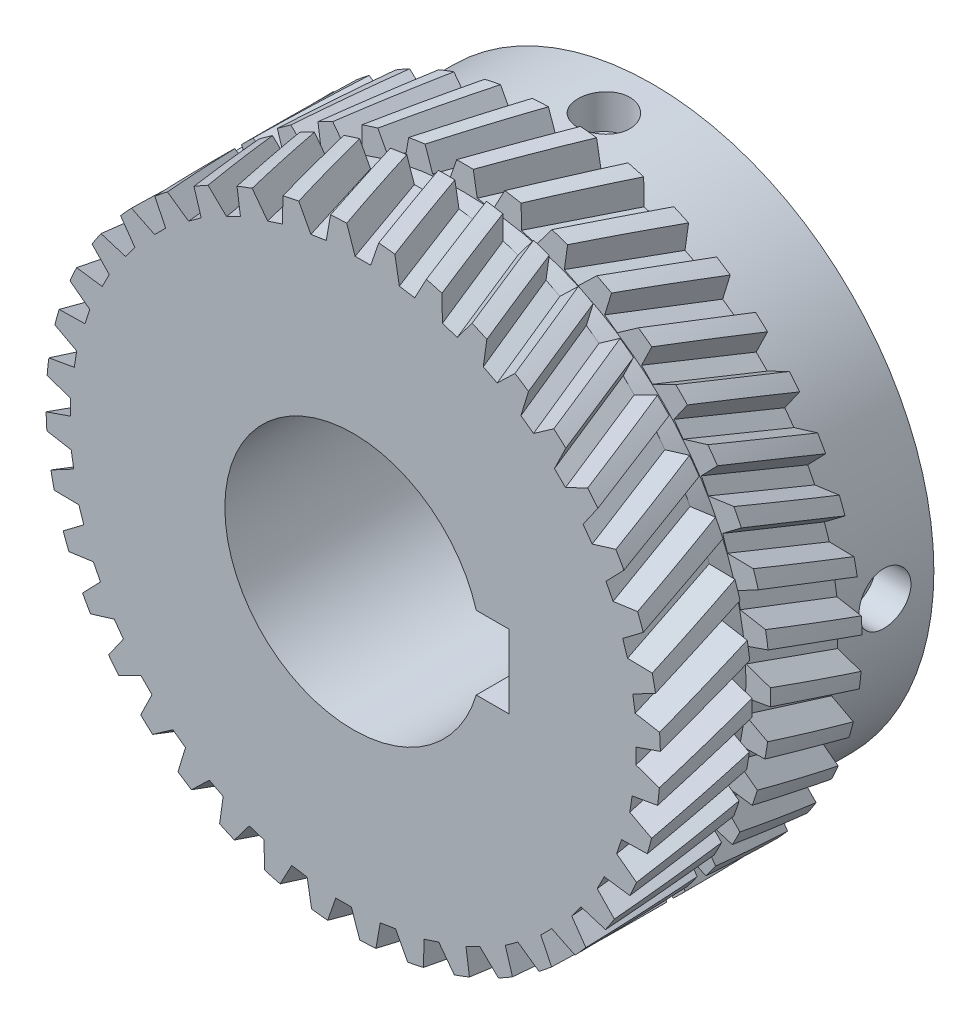
from build123d import *

# Parameters (mm, degrees)
SKETCH1_R                 = 50.2412
BOSS_EXTRUDE1_DEPTH       = 32.9946
SKETCH2_R                 = 45.974
BOSS_EXTRUDE2_DEPTH       = 16.002
CUT_EXTRUDE1_DEPTH        = 4
CUT_EXTRUDE1_DRAFT        = -18
CIRPATTERN2_COPY_1_DEPTH  = 4
CIRPATTERN2_COPY_1_DRAFT  = -18
CIRPATTERN2_COPY_2_DEPTH  = 4
CIRPATTERN2_COPY_2_DRAFT  = -18
CIRPATTERN2_COPY_3_DEPTH  = 4
CIRPATTERN2_COPY_3_DRAFT  = -18
CIRPATTERN2_COPY_4_DEPTH  = 4
CIRPATTERN2_COPY_4_DRAFT  = -18
CIRPATTERN2_COPY_5_DEPTH  = 4
CIRPATTERN2_COPY_5_DRAFT  = -18
CIRPATTERN2_COPY_6_DEPTH  = 4
CIRPATTERN2_COPY_6_DRAFT  = -18
CIRPATTERN2_COPY_7_DEPTH  = 4
CIRPATTERN2_COPY_7_DRAFT  = -18
CIRPATTERN2_COPY_8_DEPTH  = 4
CIRPATTERN2_COPY_8_DRAFT  = -18
CIRPATTERN2_COPY_9_DEPTH  = 4
CIRPATTERN2_COPY_9_DRAFT  = -18
CIRPATTERN2_COPY_10_DEPTH = 4
CIRPATTERN2_COPY_10_DRAFT = -18
CIRPATTERN2_COPY_11_DEPTH = 4
CIRPATTERN2_COPY_11_DRAFT = -18
CIRPATTERN2_COPY_12_DEPTH = 4
CIRPATTERN2_COPY_12_DRAFT = -18
CIRPATTERN2_COPY_13_DEPTH = 4
CIRPATTERN2_COPY_13_DRAFT = -18
CIRPATTERN2_COPY_14_DEPTH = 4
CIRPATTERN2_COPY_14_DRAFT = -18
CIRPATTERN2_COPY_15_DEPTH = 4
CIRPATTERN2_COPY_15_DRAFT = -18
CIRPATTERN2_COPY_16_DEPTH = 4
CIRPATTERN2_COPY_16_DRAFT = -18
CIRPATTERN2_COPY_17_DEPTH = 4
CIRPATTERN2_COPY_17_DRAFT = -18
CIRPATTERN2_COPY_18_DEPTH = 4
CIRPATTERN2_COPY_18_DRAFT = -18
CIRPATTERN2_COPY_19_DEPTH = 4
CIRPATTERN2_COPY_19_DRAFT = -18
CIRPATTERN2_COPY_20_DEPTH = 4
CIRPATTERN2_COPY_20_DRAFT = -18
CIRPATTERN2_COPY_21_DEPTH = 4
CIRPATTERN2_COPY_21_DRAFT = -18
CIRPATTERN2_COPY_22_DEPTH = 4
CIRPATTERN2_COPY_22_DRAFT = -18
CIRPATTERN2_COPY_23_DEPTH = 4
CIRPATTERN2_COPY_23_DRAFT = -18
CIRPATTERN2_COPY_24_DEPTH = 4
CIRPATTERN2_COPY_24_DRAFT = -18
CIRPATTERN2_COPY_25_DEPTH = 4
CIRPATTERN2_COPY_25_DRAFT = -18
CIRPATTERN2_COPY_26_DEPTH = 4
CIRPATTERN2_COPY_26_DRAFT = -18
CIRPATTERN2_COPY_27_DEPTH = 4
CIRPATTERN2_COPY_27_DRAFT = -18
CIRPATTERN2_COPY_28_DEPTH = 4
CIRPATTERN2_COPY_28_DRAFT = -18
CIRPATTERN2_COPY_29_DEPTH = 4
CIRPATTERN2_COPY_29_DRAFT = -18
CIRPATTERN2_COPY_30_DEPTH = 4
CIRPATTERN2_COPY_30_DRAFT = -18
CIRPATTERN2_COPY_31_DEPTH = 4
CIRPATTERN2_COPY_31_DRAFT = -18
CIRPATTERN2_COPY_32_DEPTH = 4
CIRPATTERN2_COPY_32_DRAFT = -18
CIRPATTERN2_COPY_33_DEPTH = 4
CIRPATTERN2_COPY_33_DRAFT = -18
CIRPATTERN2_COPY_34_DEPTH = 4
CIRPATTERN2_COPY_34_DRAFT = -18
CIRPATTERN2_COPY_35_DEPTH = 4
CIRPATTERN2_COPY_35_DRAFT = -18
CIRPATTERN2_COPY_36_DEPTH = 4
CIRPATTERN2_COPY_36_DRAFT = -18
CIRPATTERN2_COPY_37_DEPTH = 4
CIRPATTERN2_COPY_37_DRAFT = -18
CIRPATTERN2_COPY_38_DEPTH = 4
CIRPATTERN2_COPY_38_DRAFT = -18
CIRPATTERN2_COPY_39_DEPTH = 4
CIRPATTERN2_COPY_39_DRAFT = -18
CUT_EXTRUDE8_DEPTH        = 1.4986
CUT_EXTRUDE8_DEPTH_BACK   = 1.4986
SKETCH17_R                = 51.972836746
SKETCH17_R_2              = 46.242248426
CUT_EXTRUDE3_DEPTH        = 87.307723678
SKETCH10_R                = 4.25
CUT_EXTRUDE6_DEPTH        = 10
SKETCH11_R                = 4.25
CUT_EXTRUDE7_DEPTH        = 10
M8_TAPPED_HOLE1_D         = 6.8
M8_TAPPED_HOLE1_DEPTH     = 32.995
M8_TAPPED_HOLE1_TIP       = 2.042926105
M8_TAPPED_HOLE2_D         = 6.8
M8_TAPPED_HOLE2_DEPTH     = 32.995
M8_TAPPED_HOLE2_TIP       = 2.042926105


with BuildPart() as part:
    # Sketch1 → Boss-Extrude1 (new body)
    with BuildSketch(Plane.XY):
        Circle(SKETCH1_R)
    extrude(amount=BOSS_EXTRUDE1_DEPTH)

    # Sketch2 → Boss-Extrude2 (add)
    with BuildSketch(Plane(origin=(0, 0, 0), x_dir=(-1, 0, 0), z_dir=(0, 0, -1))):
        Circle(SKETCH2_R)
    extrude(amount=BOSS_EXTRUDE2_DEPTH)


with BuildPart() as cut_extrude1_tool:
    # Sketch4 → Cut-Extrude1 (with draft: the straight prism first)
    with BuildSketch(Plane(origin=(50.2412, 0, 0), x_dir=(0, 0, -1), z_dir=(1, 0, 0))):
        Polygon((-16.4946, 6.910378281), (-34.4946, 0.536194418), (-34.4946, -4.768053675), (-16.4946, 1.606130188), (1.5, -4.768053675), (1.5, 0.536194418), align=None)
    extrude(amount=-CUT_EXTRUDE1_DEPTH)
    # Cut-Extrude1: the draft: its side faces are tilted about the plane it starts from
    cut_extrude1_sides = [cut_extrude1_tool.faces().sort_by_distance(p)[0] for p in [
        (48.2412, 3.72328635, 25.4946),
        (48.2412, -2.115929628, 34.4946),
        (48.2412, -1.580961743, 25.4946),
        (48.2412, -1.580961743, 7.4973),
        (48.2412, -2.115929628, -1.5),
        (48.2412, 3.72328635, 7.4973),
    ]]
    draft(cut_extrude1_sides, Plane(origin=(50.2412, 0, 0), x_dir=(0, 0, -1), z_dir=(1, 0, 0)), CUT_EXTRUDE1_DRAFT)


with BuildPart() as part_1:
    add(part.part)

    # Cut-Extrude1: cut by cut_extrude1_tool
    add(cut_extrude1_tool.part, mode=Mode.SUBTRACT)


with BuildPart() as cirpattern2_copy_1_tool:
    # CirPattern2 copy 1 sketch → CirPattern2 copy 1 (with draft: the straight prism first)
    with BuildSketch(Plane(origin=(49.622647458, -7.859455245, 0), x_dir=(0, 0, -1), z_dir=(0.9876883405951378, -0.15643446504023087, 0))):
        Polygon((-16.4946, 6.910378281), (-34.4946, 0.536194418), (-34.4946, -4.768053675), (-16.4946, 1.606130188), (1.5, -4.768053675), (1.5, 0.536194418), align=None)
    extrude(amount=-CIRPATTERN2_COPY_1_DEPTH)
    # CirPattern2 copy 1: the draft: its side faces are tilted about the plane it starts from
    cirpattern2_copy_1_sides = [cirpattern2_copy_1_tool.faces().sort_by_distance(p)[0] for p in [
        (48.229721085, -3.869139798, 25.4946),
        (47.316266457, -9.636465338, 34.4946),
        (47.399953872, -9.108083795, 25.4946),
        (47.399953872, -9.108083795, 7.4973),
        (47.316266457, -9.636465338, -1.5),
        (48.229721085, -3.869139798, 7.4973),
    ]]
    draft(cirpattern2_copy_1_sides, Plane(origin=(49.622647458, -7.859455245, 0), x_dir=(0, 0, -1), z_dir=(0.9876883405951378, -0.15643446504023087, 0)), CIRPATTERN2_COPY_1_DRAFT)


with BuildPart() as part_2:
    add(part_1.part)

    # CirPattern2 copy 1: cut by cirpattern2_copy_1_tool
    add(cirpattern2_copy_1_tool.part, mode=Mode.SUBTRACT)


with BuildPart() as cirpattern2_copy_2_tool:
    # CirPattern2 copy 2 sketch → CirPattern2 copy 2 (with draft: the straight prism first)
    with BuildSketch(Plane(origin=(47.782220646, -15.525384618, 0), x_dir=(0, 0, -1), z_dir=(0.9510565162951535, -0.3090169943749474, 0))):
        Polygon((-16.4946, 6.910378281), (-34.4946, 0.536194418), (-34.4946, -4.768053675), (-16.4946, 1.606130188), (1.5, -4.768053675), (1.5, 0.536194418), align=None)
    extrude(amount=-CIRPATTERN2_COPY_2_DEPTH)
    # CirPattern2 copy 2: the draft: its side faces are tilted about the plane it starts from
    cirpattern2_copy_2_sides = [cirpattern2_copy_2_tool.faces().sort_by_distance(p)[0] for p in [
        (47.030666371, -11.366294884, 25.4946),
        (45.2262494, -16.91971929, 34.4946),
        (45.391563568, -16.410934597, 25.4946),
        (45.391563568, -16.410934597, 7.4973),
        (45.2262494, -16.91971929, -1.5),
        (47.030666371, -11.366294884, 7.4973),
    ]]
    draft(cirpattern2_copy_2_sides, Plane(origin=(47.782220646, -15.525384618, 0), x_dir=(0, 0, -1), z_dir=(0.9510565162951535, -0.3090169943749474, 0)), CIRPATTERN2_COPY_2_DRAFT)


with BuildPart() as part_3:
    add(part_2.part)

    # CirPattern2 copy 2: cut by cirpattern2_copy_2_tool
    add(cirpattern2_copy_2_tool.part, mode=Mode.SUBTRACT)


with BuildPart() as cirpattern2_copy_3_tool:
    # CirPattern2 copy 3 sketch → CirPattern2 copy 3 (with draft: the straight prism first)
    with BuildSketch(Plane(origin=(44.765236983, -22.809027496, 0), x_dir=(0, 0, -1), z_dir=(0.8910065241883679, -0.45399049973954675, 0))):
        Polygon((-16.4946, 6.910378281), (-34.4946, 0.536194418), (-34.4946, -4.768053675), (-16.4946, 1.606130188), (1.5, -4.768053675), (1.5, 0.536194418), align=None)
    extrude(amount=-CIRPATTERN2_COPY_3_DEPTH)
    # CirPattern2 copy 3: the draft: its side faces are tilted about the plane it starts from
    cirpattern2_copy_3_sides = [cirpattern2_copy_3_tool.faces().sort_by_distance(p)[0] for p in [
        (44.673560565, -18.583574067, 25.4946),
        (42.022611985, -23.786353599, 34.4946),
        (42.265482323, -23.309693724, 25.4946),
        (42.265482323, -23.309693724, 7.4973),
        (42.022611985, -23.786353599, -1.5),
        (44.673560565, -18.583574067, 7.4973),
    ]]
    draft(cirpattern2_copy_3_sides, Plane(origin=(44.765236983, -22.809027496, 0), x_dir=(0, 0, -1), z_dir=(0.8910065241883679, -0.45399049973954675, 0)), CIRPATTERN2_COPY_3_DRAFT)


with BuildPart() as part_4:
    add(part_3.part)

    # CirPattern2 copy 3: cut by cirpattern2_copy_3_tool
    add(cirpattern2_copy_3_tool.part, mode=Mode.SUBTRACT)


with BuildPart() as cirpattern2_copy_4_tool:
    # CirPattern2 copy 4 sketch → CirPattern2 copy 4 (with draft: the straight prism first)
    with BuildSketch(Plane(origin=(40.645984618, -29.531036417, 0), x_dir=(0, 0, -1), z_dir=(0.8090169943749475, -0.5877852522924731, 0))):
        Polygon((-16.4946, 6.910378281), (-34.4946, 0.536194418), (-34.4946, -4.768053675), (-16.4946, 1.606130188), (1.5, -4.768053675), (1.5, 0.536194418), align=None)
    extrude(amount=-CIRPATTERN2_COPY_4_DEPTH)
    # CirPattern2 copy 4: the draft: its side faces are tilted about the plane it starts from
    cirpattern2_copy_4_sides = [cirpattern2_copy_4_tool.faces().sort_by_distance(p)[0] for p in [
        (41.216443436, -25.343263981, 25.4946),
        (37.784238399, -30.067288941, 34.4946),
        (38.098684632, -29.63449083, 25.4946),
        (38.098684632, -29.63449083, 7.4973),
        (37.784238399, -30.067288941, -1.5),
        (41.216443436, -25.343263981, 7.4973),
    ]]
    draft(cirpattern2_copy_4_sides, Plane(origin=(40.645984618, -29.531036417, 0), x_dir=(0, 0, -1), z_dir=(0.8090169943749475, -0.5877852522924731, 0)), CIRPATTERN2_COPY_4_DRAFT)


with BuildPart() as part_5:
    add(part_4.part)

    # CirPattern2 copy 4: cut by cirpattern2_copy_4_tool
    add(cirpattern2_copy_4_tool.part, mode=Mode.SUBTRACT)


with BuildPart() as cirpattern2_copy_5_tool:
    # CirPattern2 copy 5 sketch → CirPattern2 copy 5 (with draft: the straight prism first)
    with BuildSketch(Plane(origin=(35.525893215, -35.525893215, 0), x_dir=(0, 0, -1), z_dir=(0.7071067811865476, -0.7071067811865475, 0))):
        Polygon((-16.4946, 6.910378281), (-34.4946, 0.536194418), (-34.4946, -4.768053675), (-16.4946, 1.606130188), (1.5, -4.768053675), (1.5, 0.536194418), align=None)
    extrude(amount=-CIRPATTERN2_COPY_5_DEPTH)
    # CirPattern2 copy 5: the draft: its side faces are tilted about the plane it starts from
    cirpattern2_copy_5_sides = [cirpattern2_copy_5_tool.faces().sort_by_distance(p)[0] for p in [
        (36.744440679, -31.478918626, 25.4946),
        (32.615491464, -35.607867841, 34.4946),
        (32.993770883, -35.229588422, 25.4946),
        (32.993770883, -35.229588422, 7.4973),
        (32.615491464, -35.607867841, -1.5),
        (36.744440679, -31.478918626, 7.4973),
    ]]
    draft(cirpattern2_copy_5_sides, Plane(origin=(35.525893215, -35.525893215, 0), x_dir=(0, 0, -1), z_dir=(0.7071067811865476, -0.7071067811865475, 0)), CIRPATTERN2_COPY_5_DRAFT)


with BuildPart() as part_6:
    add(part_5.part)

    # CirPattern2 copy 5: cut by cirpattern2_copy_5_tool
    add(cirpattern2_copy_5_tool.part, mode=Mode.SUBTRACT)


with BuildPart() as cirpattern2_copy_6_tool:
    # CirPattern2 copy 6 sketch → CirPattern2 copy 6 (with draft: the straight prism first)
    with BuildSketch(Plane(origin=(29.531036417, -40.645984618, 0), x_dir=(0, 0, -1), z_dir=(0.5877852522924731, -0.8090169943749475, 0))):
        Polygon((-16.4946, 6.910378281), (-34.4946, 0.536194418), (-34.4946, -4.768053675), (-16.4946, 1.606130188), (1.5, -4.768053675), (1.5, 0.536194418), align=None)
    extrude(amount=-CIRPATTERN2_COPY_6_DEPTH)
    # CirPattern2 copy 6: the draft: its side faces are tilted about the plane it starts from
    cirpattern2_copy_6_sides = [cirpattern2_copy_6_tool.faces().sort_by_distance(p)[0] for p in [
        (31.367667845, -36.839457822, 25.4946),
        (26.643642885, -40.271662859, 34.4946),
        (27.076440995, -39.957216626, 25.4946),
        (27.076440995, -39.957216626, 7.4973),
        (26.643642885, -40.271662859, -1.5),
        (31.367667845, -36.839457822, 7.4973),
    ]]
    draft(cirpattern2_copy_6_sides, Plane(origin=(29.531036417, -40.645984618, 0), x_dir=(0, 0, -1), z_dir=(0.5877852522924731, -0.8090169943749475, 0)), CIRPATTERN2_COPY_6_DRAFT)


with BuildPart() as part_7:
    add(part_6.part)

    # CirPattern2 copy 6: cut by cirpattern2_copy_6_tool
    add(cirpattern2_copy_6_tool.part, mode=Mode.SUBTRACT)


with BuildPart() as cirpattern2_copy_7_tool:
    # CirPattern2 copy 7 sketch → CirPattern2 copy 7 (with draft: the straight prism first)
    with BuildSketch(Plane(origin=(22.809027496, -44.765236983, 0), x_dir=(0, 0, -1), z_dir=(0.4539904997395468, -0.8910065241883678, 0))):
        Polygon((-16.4946, 6.910378281), (-34.4946, 0.536194418), (-34.4946, -4.768053675), (-16.4946, 1.606130188), (1.5, -4.768053675), (1.5, 0.536194418), align=None)
    extrude(amount=-CIRPATTERN2_COPY_7_DEPTH)
    # CirPattern2 copy 7: the draft: its side faces are tilted about the plane it starts from
    cirpattern2_copy_7_sides = [cirpattern2_copy_7_tool.faces().sort_by_distance(p)[0] for p in [
        (25.218518925, -41.292887304, 25.4946),
        (20.015739393, -43.943835884, 34.4946),
        (20.492399269, -43.700965546, 25.4946),
        (20.492399269, -43.700965546, 7.4973),
        (20.015739393, -43.943835884, -1.5),
        (25.218518925, -41.292887304, 7.4973),
    ]]
    draft(cirpattern2_copy_7_sides, Plane(origin=(22.809027496, -44.765236983, 0), x_dir=(0, 0, -1), z_dir=(0.4539904997395468, -0.8910065241883678, 0)), CIRPATTERN2_COPY_7_DRAFT)


with BuildPart() as part_8:
    add(part_7.part)

    # CirPattern2 copy 7: cut by cirpattern2_copy_7_tool
    add(cirpattern2_copy_7_tool.part, mode=Mode.SUBTRACT)


with BuildPart() as cirpattern2_copy_8_tool:
    # CirPattern2 copy 8 sketch → CirPattern2 copy 8 (with draft: the straight prism first)
    with BuildSketch(Plane(origin=(15.525384618, -47.782220646, 0), x_dir=(0, 0, -1), z_dir=(0.30901699437494745, -0.9510565162951535, 0))):
        Polygon((-16.4946, 6.910378281), (-34.4946, 0.536194418), (-34.4946, -4.768053675), (-16.4946, 1.606130188), (1.5, -4.768053675), (1.5, 0.536194418), align=None)
    extrude(amount=-CIRPATTERN2_COPY_8_DEPTH)
    # CirPattern2 copy 8: the draft: its side faces are tilted about the plane it starts from
    cirpattern2_copy_8_sides = [cirpattern2_copy_8_tool.faces().sort_by_distance(p)[0] for p in [
        (18.448406374, -44.729548857, 25.4946),
        (12.894981968, -46.533965828, 34.4946),
        (13.403766661, -46.36865166, 25.4946),
        (13.403766661, -46.36865166, 7.4973),
        (12.894981968, -46.533965828, -1.5),
        (18.448406374, -44.729548857, 7.4973),
    ]]
    draft(cirpattern2_copy_8_sides, Plane(origin=(15.525384618, -47.782220646, 0), x_dir=(0, 0, -1), z_dir=(0.30901699437494745, -0.9510565162951535, 0)), CIRPATTERN2_COPY_8_DRAFT)


with BuildPart() as part_9:
    add(part_8.part)

    # CirPattern2 copy 8: cut by cirpattern2_copy_8_tool
    add(cirpattern2_copy_8_tool.part, mode=Mode.SUBTRACT)


with BuildPart() as cirpattern2_copy_9_tool:
    # CirPattern2 copy 9 sketch → CirPattern2 copy 9 (with draft: the straight prism first)
    with BuildSketch(Plane(origin=(7.859455245, -49.622647458, 0), x_dir=(0, 0, -1), z_dir=(0.15643446504023092, -0.9876883405951378, 0))):
        Polygon((-16.4946, 6.910378281), (-34.4946, 0.536194418), (-34.4946, -4.768053675), (-16.4946, 1.606130188), (1.5, -4.768053675), (1.5, 0.536194418), align=None)
    extrude(amount=-CIRPATTERN2_COPY_9_DEPTH)
    # CirPattern2 copy 9: the draft: its side faces are tilted about the plane it starts from
    cirpattern2_copy_9_sides = [cirpattern2_copy_9_tool.faces().sort_by_distance(p)[0] for p in [
        (11.224032831, -47.064820468, 25.4946),
        (5.456707292, -47.978275096, 34.4946),
        (5.985088834, -47.894587681, 25.4946),
        (5.985088834, -47.894587681, 7.4973),
        (5.456707292, -47.978275096, -1.5),
        (11.224032831, -47.064820468, 7.4973),
    ]]
    draft(cirpattern2_copy_9_sides, Plane(origin=(7.859455245, -49.622647458, 0), x_dir=(0, 0, -1), z_dir=(0.15643446504023092, -0.9876883405951378, 0)), CIRPATTERN2_COPY_9_DRAFT)


with BuildPart() as part_10:
    add(part_9.part)

    # CirPattern2 copy 9: cut by cirpattern2_copy_9_tool
    add(cirpattern2_copy_9_tool.part, mode=Mode.SUBTRACT)


with BuildPart() as cirpattern2_copy_10_tool:
    # CirPattern2 copy 10 sketch → CirPattern2 copy 10 (with draft: the straight prism first)
    with BuildSketch(Plane(origin=(0, -50.2412, 0), x_dir=(0, 0, -1), z_dir=(0, -1, 0))):
        Polygon((-16.4946, 6.910378281), (-34.4946, 0.536194418), (-34.4946, -4.768053675), (-16.4946, 1.606130188), (1.5, -4.768053675), (1.5, 0.536194418), align=None)
    extrude(amount=-CIRPATTERN2_COPY_10_DEPTH)
    # CirPattern2 copy 10: the draft: its side faces are tilted about the plane it starts from
    cirpattern2_copy_10_sides = [cirpattern2_copy_10_tool.faces().sort_by_distance(p)[0] for p in [
        (3.72328635, -48.2412, 25.4946),
        (-2.115929628, -48.2412, 34.4946),
        (-1.580961743, -48.2412, 25.4946),
        (-1.580961743, -48.2412, 7.4973),
        (-2.115929628, -48.2412, -1.5),
        (3.72328635, -48.2412, 7.4973),
    ]]
    draft(cirpattern2_copy_10_sides, Plane(origin=(0, -50.2412, 0), x_dir=(0, 0, -1), z_dir=(0, -1, 0)), CIRPATTERN2_COPY_10_DRAFT)


with BuildPart() as part_11:
    add(part_10.part)

    # CirPattern2 copy 10: cut by cirpattern2_copy_10_tool
    add(cirpattern2_copy_10_tool.part, mode=Mode.SUBTRACT)


with BuildPart() as cirpattern2_copy_11_tool:
    # CirPattern2 copy 11 sketch → CirPattern2 copy 11 (with draft: the straight prism first)
    with BuildSketch(Plane(origin=(-7.859455245, -49.622647458, 0), x_dir=(0, 0, -1), z_dir=(-0.1564344650402308, -0.9876883405951378, 0))):
        Polygon((-16.4946, 6.910378281), (-34.4946, 0.536194418), (-34.4946, -4.768053675), (-16.4946, 1.606130188), (1.5, -4.768053675), (1.5, 0.536194418), align=None)
    extrude(amount=-CIRPATTERN2_COPY_11_DEPTH)
    # CirPattern2 copy 11: the draft: its side faces are tilted about the plane it starts from
    cirpattern2_copy_11_sides = [cirpattern2_copy_11_tool.faces().sort_by_distance(p)[0] for p in [
        (-3.869139798, -48.229721085, 25.4946),
        (-9.636465338, -47.316266457, 34.4946),
        (-9.108083795, -47.399953872, 25.4946),
        (-9.108083795, -47.399953872, 7.4973),
        (-9.636465338, -47.316266457, -1.5),
        (-3.869139798, -48.229721085, 7.4973),
    ]]
    draft(cirpattern2_copy_11_sides, Plane(origin=(-7.859455245, -49.622647458, 0), x_dir=(0, 0, -1), z_dir=(-0.1564344650402308, -0.9876883405951378, 0)), CIRPATTERN2_COPY_11_DRAFT)


with BuildPart() as part_12:
    add(part_11.part)

    # CirPattern2 copy 11: cut by cirpattern2_copy_11_tool
    add(cirpattern2_copy_11_tool.part, mode=Mode.SUBTRACT)


with BuildPart() as cirpattern2_copy_12_tool:
    # CirPattern2 copy 12 sketch → CirPattern2 copy 12 (with draft: the straight prism first)
    with BuildSketch(Plane(origin=(-15.525384618, -47.782220646, 0), x_dir=(0, 0, -1), z_dir=(-0.30901699437494734, -0.9510565162951536, 0))):
        Polygon((-16.4946, 6.910378281), (-34.4946, 0.536194418), (-34.4946, -4.768053675), (-16.4946, 1.606130188), (1.5, -4.768053675), (1.5, 0.536194418), align=None)
    extrude(amount=-CIRPATTERN2_COPY_12_DEPTH)
    # CirPattern2 copy 12: the draft: its side faces are tilted about the plane it starts from
    cirpattern2_copy_12_sides = [cirpattern2_copy_12_tool.faces().sort_by_distance(p)[0] for p in [
        (-11.366294884, -47.030666371, 25.4946),
        (-16.91971929, -45.2262494, 34.4946),
        (-16.410934597, -45.391563568, 25.4946),
        (-16.410934597, -45.391563568, 7.4973),
        (-16.91971929, -45.2262494, -1.5),
        (-11.366294884, -47.030666371, 7.4973),
    ]]
    draft(cirpattern2_copy_12_sides, Plane(origin=(-15.525384618, -47.782220646, 0), x_dir=(0, 0, -1), z_dir=(-0.30901699437494734, -0.9510565162951536, 0)), CIRPATTERN2_COPY_12_DRAFT)


with BuildPart() as part_13:
    add(part_12.part)

    # CirPattern2 copy 12: cut by cirpattern2_copy_12_tool
    add(cirpattern2_copy_12_tool.part, mode=Mode.SUBTRACT)


with BuildPart() as cirpattern2_copy_13_tool:
    # CirPattern2 copy 13 sketch → CirPattern2 copy 13 (with draft: the straight prism first)
    with BuildSketch(Plane(origin=(-22.809027496, -44.765236983, 0), x_dir=(0, 0, -1), z_dir=(-0.4539904997395467, -0.8910065241883679, 0))):
        Polygon((-16.4946, 6.910378281), (-34.4946, 0.536194418), (-34.4946, -4.768053675), (-16.4946, 1.606130188), (1.5, -4.768053675), (1.5, 0.536194418), align=None)
    extrude(amount=-CIRPATTERN2_COPY_13_DEPTH)
    # CirPattern2 copy 13: the draft: its side faces are tilted about the plane it starts from
    cirpattern2_copy_13_sides = [cirpattern2_copy_13_tool.faces().sort_by_distance(p)[0] for p in [
        (-18.583574067, -44.673560565, 25.4946),
        (-23.786353599, -42.022611985, 34.4946),
        (-23.309693724, -42.265482323, 25.4946),
        (-23.309693724, -42.265482323, 7.4973),
        (-23.786353599, -42.022611985, -1.5),
        (-18.583574067, -44.673560565, 7.4973),
    ]]
    draft(cirpattern2_copy_13_sides, Plane(origin=(-22.809027496, -44.765236983, 0), x_dir=(0, 0, -1), z_dir=(-0.4539904997395467, -0.8910065241883679, 0)), CIRPATTERN2_COPY_13_DRAFT)


with BuildPart() as part_14:
    add(part_13.part)

    # CirPattern2 copy 13: cut by cirpattern2_copy_13_tool
    add(cirpattern2_copy_13_tool.part, mode=Mode.SUBTRACT)


with BuildPart() as cirpattern2_copy_14_tool:
    # CirPattern2 copy 14 sketch → CirPattern2 copy 14 (with draft: the straight prism first)
    with BuildSketch(Plane(origin=(-29.531036417, -40.645984618, 0), x_dir=(0, 0, -1), z_dir=(-0.587785252292473, -0.8090169943749475, 0))):
        Polygon((-16.4946, 6.910378281), (-34.4946, 0.536194418), (-34.4946, -4.768053675), (-16.4946, 1.606130188), (1.5, -4.768053675), (1.5, 0.536194418), align=None)
    extrude(amount=-CIRPATTERN2_COPY_14_DEPTH)
    # CirPattern2 copy 14: the draft: its side faces are tilted about the plane it starts from
    cirpattern2_copy_14_sides = [cirpattern2_copy_14_tool.faces().sort_by_distance(p)[0] for p in [
        (-25.343263981, -41.216443436, 25.4946),
        (-30.067288941, -37.784238399, 34.4946),
        (-29.63449083, -38.098684632, 25.4946),
        (-29.63449083, -38.098684632, 7.4973),
        (-30.067288941, -37.784238399, -1.5),
        (-25.343263981, -41.216443436, 7.4973),
    ]]
    draft(cirpattern2_copy_14_sides, Plane(origin=(-29.531036417, -40.645984618, 0), x_dir=(0, 0, -1), z_dir=(-0.587785252292473, -0.8090169943749475, 0)), CIRPATTERN2_COPY_14_DRAFT)


with BuildPart() as part_15:
    add(part_14.part)

    # CirPattern2 copy 14: cut by cirpattern2_copy_14_tool
    add(cirpattern2_copy_14_tool.part, mode=Mode.SUBTRACT)


with BuildPart() as cirpattern2_copy_15_tool:
    # CirPattern2 copy 15 sketch → CirPattern2 copy 15 (with draft: the straight prism first)
    with BuildSketch(Plane(origin=(-35.525893215, -35.525893215, 0), x_dir=(0, 0, -1), z_dir=(-0.7071067811865475, -0.7071067811865476, 0))):
        Polygon((-16.4946, 6.910378281), (-34.4946, 0.536194418), (-34.4946, -4.768053675), (-16.4946, 1.606130188), (1.5, -4.768053675), (1.5, 0.536194418), align=None)
    extrude(amount=-CIRPATTERN2_COPY_15_DEPTH)
    # CirPattern2 copy 15: the draft: its side faces are tilted about the plane it starts from
    cirpattern2_copy_15_sides = [cirpattern2_copy_15_tool.faces().sort_by_distance(p)[0] for p in [
        (-31.478918626, -36.744440679, 25.4946),
        (-35.607867841, -32.615491464, 34.4946),
        (-35.229588422, -32.993770883, 25.4946),
        (-35.229588422, -32.993770883, 7.4973),
        (-35.607867841, -32.615491464, -1.5),
        (-31.478918626, -36.744440679, 7.4973),
    ]]
    draft(cirpattern2_copy_15_sides, Plane(origin=(-35.525893215, -35.525893215, 0), x_dir=(0, 0, -1), z_dir=(-0.7071067811865475, -0.7071067811865476, 0)), CIRPATTERN2_COPY_15_DRAFT)


with BuildPart() as part_16:
    add(part_15.part)

    # CirPattern2 copy 15: cut by cirpattern2_copy_15_tool
    add(cirpattern2_copy_15_tool.part, mode=Mode.SUBTRACT)


with BuildPart() as cirpattern2_copy_16_tool:
    # CirPattern2 copy 16 sketch → CirPattern2 copy 16 (with draft: the straight prism first)
    with BuildSketch(Plane(origin=(-40.645984618, -29.531036417, 0), x_dir=(0, 0, -1), z_dir=(-0.8090169943749473, -0.5877852522924732, 0))):
        Polygon((-16.4946, 6.910378281), (-34.4946, 0.536194418), (-34.4946, -4.768053675), (-16.4946, 1.606130188), (1.5, -4.768053675), (1.5, 0.536194418), align=None)
    extrude(amount=-CIRPATTERN2_COPY_16_DEPTH)
    # CirPattern2 copy 16: the draft: its side faces are tilted about the plane it starts from
    cirpattern2_copy_16_sides = [cirpattern2_copy_16_tool.faces().sort_by_distance(p)[0] for p in [
        (-36.839457822, -31.367667845, 25.4946),
        (-40.271662859, -26.643642885, 34.4946),
        (-39.957216626, -27.076440995, 25.4946),
        (-39.957216626, -27.076440995, 7.4973),
        (-40.271662859, -26.643642885, -1.5),
        (-36.839457822, -31.367667845, 7.4973),
    ]]
    draft(cirpattern2_copy_16_sides, Plane(origin=(-40.645984618, -29.531036417, 0), x_dir=(0, 0, -1), z_dir=(-0.8090169943749473, -0.5877852522924732, 0)), CIRPATTERN2_COPY_16_DRAFT)


with BuildPart() as part_17:
    add(part_16.part)

    # CirPattern2 copy 16: cut by cirpattern2_copy_16_tool
    add(cirpattern2_copy_16_tool.part, mode=Mode.SUBTRACT)


with BuildPart() as cirpattern2_copy_17_tool:
    # CirPattern2 copy 17 sketch → CirPattern2 copy 17 (with draft: the straight prism first)
    with BuildSketch(Plane(origin=(-44.765236983, -22.809027496, 0), x_dir=(0, 0, -1), z_dir=(-0.8910065241883678, -0.45399049973954686, 0))):
        Polygon((-16.4946, 6.910378281), (-34.4946, 0.536194418), (-34.4946, -4.768053675), (-16.4946, 1.606130188), (1.5, -4.768053675), (1.5, 0.536194418), align=None)
    extrude(amount=-CIRPATTERN2_COPY_17_DEPTH)
    # CirPattern2 copy 17: the draft: its side faces are tilted about the plane it starts from
    cirpattern2_copy_17_sides = [cirpattern2_copy_17_tool.faces().sort_by_distance(p)[0] for p in [
        (-41.292887304, -25.218518925, 25.4946),
        (-43.943835884, -20.015739393, 34.4946),
        (-43.700965546, -20.492399269, 25.4946),
        (-43.700965546, -20.492399269, 7.4973),
        (-43.943835884, -20.015739393, -1.5),
        (-41.292887304, -25.218518925, 7.4973),
    ]]
    draft(cirpattern2_copy_17_sides, Plane(origin=(-44.765236983, -22.809027496, 0), x_dir=(0, 0, -1), z_dir=(-0.8910065241883678, -0.45399049973954686, 0)), CIRPATTERN2_COPY_17_DRAFT)


with BuildPart() as part_18:
    add(part_17.part)

    # CirPattern2 copy 17: cut by cirpattern2_copy_17_tool
    add(cirpattern2_copy_17_tool.part, mode=Mode.SUBTRACT)


with BuildPart() as cirpattern2_copy_18_tool:
    # CirPattern2 copy 18 sketch → CirPattern2 copy 18 (with draft: the straight prism first)
    with BuildSketch(Plane(origin=(-47.782220646, -15.525384618, 0), x_dir=(0, 0, -1), z_dir=(-0.9510565162951535, -0.3090169943749475, 0))):
        Polygon((-16.4946, 6.910378281), (-34.4946, 0.536194418), (-34.4946, -4.768053675), (-16.4946, 1.606130188), (1.5, -4.768053675), (1.5, 0.536194418), align=None)
    extrude(amount=-CIRPATTERN2_COPY_18_DEPTH)
    # CirPattern2 copy 18: the draft: its side faces are tilted about the plane it starts from
    cirpattern2_copy_18_sides = [cirpattern2_copy_18_tool.faces().sort_by_distance(p)[0] for p in [
        (-44.729548857, -18.448406374, 25.4946),
        (-46.533965828, -12.894981968, 34.4946),
        (-46.36865166, -13.403766661, 25.4946),
        (-46.36865166, -13.403766661, 7.4973),
        (-46.533965828, -12.894981968, -1.5),
        (-44.729548857, -18.448406374, 7.4973),
    ]]
    draft(cirpattern2_copy_18_sides, Plane(origin=(-47.782220646, -15.525384618, 0), x_dir=(0, 0, -1), z_dir=(-0.9510565162951535, -0.3090169943749475, 0)), CIRPATTERN2_COPY_18_DRAFT)


with BuildPart() as part_19:
    add(part_18.part)

    # CirPattern2 copy 18: cut by cirpattern2_copy_18_tool
    add(cirpattern2_copy_18_tool.part, mode=Mode.SUBTRACT)


with BuildPart() as cirpattern2_copy_19_tool:
    # CirPattern2 copy 19 sketch → CirPattern2 copy 19 (with draft: the straight prism first)
    with BuildSketch(Plane(origin=(-49.622647458, -7.859455245, 0), x_dir=(0, 0, -1), z_dir=(-0.9876883405951377, -0.15643446504023098, 0))):
        Polygon((-16.4946, 6.910378281), (-34.4946, 0.536194418), (-34.4946, -4.768053675), (-16.4946, 1.606130188), (1.5, -4.768053675), (1.5, 0.536194418), align=None)
    extrude(amount=-CIRPATTERN2_COPY_19_DEPTH)
    # CirPattern2 copy 19: the draft: its side faces are tilted about the plane it starts from
    cirpattern2_copy_19_sides = [cirpattern2_copy_19_tool.faces().sort_by_distance(p)[0] for p in [
        (-47.064820468, -11.224032831, 25.4946),
        (-47.978275096, -5.456707292, 34.4946),
        (-47.894587681, -5.985088834, 25.4946),
        (-47.894587681, -5.985088834, 7.4973),
        (-47.978275096, -5.456707292, -1.5),
        (-47.064820468, -11.224032831, 7.4973),
    ]]
    draft(cirpattern2_copy_19_sides, Plane(origin=(-49.622647458, -7.859455245, 0), x_dir=(0, 0, -1), z_dir=(-0.9876883405951377, -0.15643446504023098, 0)), CIRPATTERN2_COPY_19_DRAFT)


with BuildPart() as part_20:
    add(part_19.part)

    # CirPattern2 copy 19: cut by cirpattern2_copy_19_tool
    add(cirpattern2_copy_19_tool.part, mode=Mode.SUBTRACT)


with BuildPart() as cirpattern2_copy_20_tool:
    # CirPattern2 copy 20 sketch → CirPattern2 copy 20 (with draft: the straight prism first)
    with BuildSketch(Plane(origin=(-50.2412, 0, 0), x_dir=(0, 0, -1), z_dir=(-1, 0, 0))):
        Polygon((-16.4946, 6.910378281), (-34.4946, 0.536194418), (-34.4946, -4.768053675), (-16.4946, 1.606130188), (1.5, -4.768053675), (1.5, 0.536194418), align=None)
    extrude(amount=-CIRPATTERN2_COPY_20_DEPTH)
    # CirPattern2 copy 20: the draft: its side faces are tilted about the plane it starts from
    cirpattern2_copy_20_sides = [cirpattern2_copy_20_tool.faces().sort_by_distance(p)[0] for p in [
        (-48.2412, -3.72328635, 25.4946),
        (-48.2412, 2.115929628, 34.4946),
        (-48.2412, 1.580961743, 25.4946),
        (-48.2412, 1.580961743, 7.4973),
        (-48.2412, 2.115929628, -1.5),
        (-48.2412, -3.72328635, 7.4973),
    ]]
    draft(cirpattern2_copy_20_sides, Plane(origin=(-50.2412, 0, 0), x_dir=(0, 0, -1), z_dir=(-1, 0, 0)), CIRPATTERN2_COPY_20_DRAFT)


with BuildPart() as part_21:
    add(part_20.part)

    # CirPattern2 copy 20: cut by cirpattern2_copy_20_tool
    add(cirpattern2_copy_20_tool.part, mode=Mode.SUBTRACT)


with BuildPart() as cirpattern2_copy_21_tool:
    # CirPattern2 copy 21 sketch → CirPattern2 copy 21 (with draft: the straight prism first)
    with BuildSketch(Plane(origin=(-49.622647458, 7.859455245, 0), x_dir=(0, 0, -1), z_dir=(-0.9876883405951378, 0.15643446504023073, 0))):
        Polygon((-16.4946, 6.910378281), (-34.4946, 0.536194418), (-34.4946, -4.768053675), (-16.4946, 1.606130188), (1.5, -4.768053675), (1.5, 0.536194418), align=None)
    extrude(amount=-CIRPATTERN2_COPY_21_DEPTH)
    # CirPattern2 copy 21: the draft: its side faces are tilted about the plane it starts from
    cirpattern2_copy_21_sides = [cirpattern2_copy_21_tool.faces().sort_by_distance(p)[0] for p in [
        (-48.229721085, 3.869139798, 25.4946),
        (-47.316266457, 9.636465338, 34.4946),
        (-47.399953872, 9.108083795, 25.4946),
        (-47.399953872, 9.108083795, 7.4973),
        (-47.316266457, 9.636465338, -1.5),
        (-48.229721085, 3.869139798, 7.4973),
    ]]
    draft(cirpattern2_copy_21_sides, Plane(origin=(-49.622647458, 7.859455245, 0), x_dir=(0, 0, -1), z_dir=(-0.9876883405951378, 0.15643446504023073, 0)), CIRPATTERN2_COPY_21_DRAFT)


with BuildPart() as part_22:
    add(part_21.part)

    # CirPattern2 copy 21: cut by cirpattern2_copy_21_tool
    add(cirpattern2_copy_21_tool.part, mode=Mode.SUBTRACT)


with BuildPart() as cirpattern2_copy_22_tool:
    # CirPattern2 copy 22 sketch → CirPattern2 copy 22 (with draft: the straight prism first)
    with BuildSketch(Plane(origin=(-47.782220646, 15.525384618, 0), x_dir=(0, 0, -1), z_dir=(-0.9510565162951536, 0.3090169943749473, 0))):
        Polygon((-16.4946, 6.910378281), (-34.4946, 0.536194418), (-34.4946, -4.768053675), (-16.4946, 1.606130188), (1.5, -4.768053675), (1.5, 0.536194418), align=None)
    extrude(amount=-CIRPATTERN2_COPY_22_DEPTH)
    # CirPattern2 copy 22: the draft: its side faces are tilted about the plane it starts from
    cirpattern2_copy_22_sides = [cirpattern2_copy_22_tool.faces().sort_by_distance(p)[0] for p in [
        (-47.030666371, 11.366294884, 25.4946),
        (-45.2262494, 16.91971929, 34.4946),
        (-45.391563568, 16.410934597, 25.4946),
        (-45.391563568, 16.410934597, 7.4973),
        (-45.2262494, 16.91971929, -1.5),
        (-47.030666371, 11.366294884, 7.4973),
    ]]
    draft(cirpattern2_copy_22_sides, Plane(origin=(-47.782220646, 15.525384618, 0), x_dir=(0, 0, -1), z_dir=(-0.9510565162951536, 0.3090169943749473, 0)), CIRPATTERN2_COPY_22_DRAFT)


with BuildPart() as part_23:
    add(part_22.part)

    # CirPattern2 copy 22: cut by cirpattern2_copy_22_tool
    add(cirpattern2_copy_22_tool.part, mode=Mode.SUBTRACT)


with BuildPart() as cirpattern2_copy_23_tool:
    # CirPattern2 copy 23 sketch → CirPattern2 copy 23 (with draft: the straight prism first)
    with BuildSketch(Plane(origin=(-44.765236983, 22.809027496, 0), x_dir=(0, 0, -1), z_dir=(-0.8910065241883679, 0.4539904997395467, 0))):
        Polygon((-16.4946, 6.910378281), (-34.4946, 0.536194418), (-34.4946, -4.768053675), (-16.4946, 1.606130188), (1.5, -4.768053675), (1.5, 0.536194418), align=None)
    extrude(amount=-CIRPATTERN2_COPY_23_DEPTH)
    # CirPattern2 copy 23: the draft: its side faces are tilted about the plane it starts from
    cirpattern2_copy_23_sides = [cirpattern2_copy_23_tool.faces().sort_by_distance(p)[0] for p in [
        (-44.673560565, 18.583574067, 25.4946),
        (-42.022611985, 23.786353599, 34.4946),
        (-42.265482323, 23.309693724, 25.4946),
        (-42.265482323, 23.309693724, 7.4973),
        (-42.022611985, 23.786353599, -1.5),
        (-44.673560565, 18.583574067, 7.4973),
    ]]
    draft(cirpattern2_copy_23_sides, Plane(origin=(-44.765236983, 22.809027496, 0), x_dir=(0, 0, -1), z_dir=(-0.8910065241883679, 0.4539904997395467, 0)), CIRPATTERN2_COPY_23_DRAFT)


with BuildPart() as part_24:
    add(part_23.part)

    # CirPattern2 copy 23: cut by cirpattern2_copy_23_tool
    add(cirpattern2_copy_23_tool.part, mode=Mode.SUBTRACT)


with BuildPart() as cirpattern2_copy_24_tool:
    # CirPattern2 copy 24 sketch → CirPattern2 copy 24 (with draft: the straight prism first)
    with BuildSketch(Plane(origin=(-40.645984618, 29.531036417, 0), x_dir=(0, 0, -1), z_dir=(-0.8090169943749476, 0.587785252292473, 0))):
        Polygon((-16.4946, 6.910378281), (-34.4946, 0.536194418), (-34.4946, -4.768053675), (-16.4946, 1.606130188), (1.5, -4.768053675), (1.5, 0.536194418), align=None)
    extrude(amount=-CIRPATTERN2_COPY_24_DEPTH)
    # CirPattern2 copy 24: the draft: its side faces are tilted about the plane it starts from
    cirpattern2_copy_24_sides = [cirpattern2_copy_24_tool.faces().sort_by_distance(p)[0] for p in [
        (-41.216443436, 25.343263981, 25.4946),
        (-37.784238399, 30.067288941, 34.4946),
        (-38.098684632, 29.63449083, 25.4946),
        (-38.098684632, 29.63449083, 7.4973),
        (-37.784238399, 30.067288941, -1.5),
        (-41.216443436, 25.343263981, 7.4973),
    ]]
    draft(cirpattern2_copy_24_sides, Plane(origin=(-40.645984618, 29.531036417, 0), x_dir=(0, 0, -1), z_dir=(-0.8090169943749476, 0.587785252292473, 0)), CIRPATTERN2_COPY_24_DRAFT)


with BuildPart() as part_25:
    add(part_24.part)

    # CirPattern2 copy 24: cut by cirpattern2_copy_24_tool
    add(cirpattern2_copy_24_tool.part, mode=Mode.SUBTRACT)


with BuildPart() as cirpattern2_copy_25_tool:
    # CirPattern2 copy 25 sketch → CirPattern2 copy 25 (with draft: the straight prism first)
    with BuildSketch(Plane(origin=(-35.525893215, 35.525893215, 0), x_dir=(0, 0, -1), z_dir=(-0.7071067811865477, 0.7071067811865475, 0))):
        Polygon((-16.4946, 6.910378281), (-34.4946, 0.536194418), (-34.4946, -4.768053675), (-16.4946, 1.606130188), (1.5, -4.768053675), (1.5, 0.536194418), align=None)
    extrude(amount=-CIRPATTERN2_COPY_25_DEPTH)
    # CirPattern2 copy 25: the draft: its side faces are tilted about the plane it starts from
    cirpattern2_copy_25_sides = [cirpattern2_copy_25_tool.faces().sort_by_distance(p)[0] for p in [
        (-36.744440679, 31.478918626, 25.4946),
        (-32.615491464, 35.607867841, 34.4946),
        (-32.993770883, 35.229588422, 25.4946),
        (-32.993770883, 35.229588422, 7.4973),
        (-32.615491464, 35.607867841, -1.5),
        (-36.744440679, 31.478918626, 7.4973),
    ]]
    draft(cirpattern2_copy_25_sides, Plane(origin=(-35.525893215, 35.525893215, 0), x_dir=(0, 0, -1), z_dir=(-0.7071067811865477, 0.7071067811865475, 0)), CIRPATTERN2_COPY_25_DRAFT)


with BuildPart() as part_26:
    add(part_25.part)

    # CirPattern2 copy 25: cut by cirpattern2_copy_25_tool
    add(cirpattern2_copy_25_tool.part, mode=Mode.SUBTRACT)


with BuildPart() as cirpattern2_copy_26_tool:
    # CirPattern2 copy 26 sketch → CirPattern2 copy 26 (with draft: the straight prism first)
    with BuildSketch(Plane(origin=(-29.531036417, 40.645984618, 0), x_dir=(0, 0, -1), z_dir=(-0.5877852522924732, 0.8090169943749473, 0))):
        Polygon((-16.4946, 6.910378281), (-34.4946, 0.536194418), (-34.4946, -4.768053675), (-16.4946, 1.606130188), (1.5, -4.768053675), (1.5, 0.536194418), align=None)
    extrude(amount=-CIRPATTERN2_COPY_26_DEPTH)
    # CirPattern2 copy 26: the draft: its side faces are tilted about the plane it starts from
    cirpattern2_copy_26_sides = [cirpattern2_copy_26_tool.faces().sort_by_distance(p)[0] for p in [
        (-31.367667845, 36.839457822, 25.4946),
        (-26.643642885, 40.271662859, 34.4946),
        (-27.076440995, 39.957216626, 25.4946),
        (-27.076440995, 39.957216626, 7.4973),
        (-26.643642885, 40.271662859, -1.5),
        (-31.367667845, 36.839457822, 7.4973),
    ]]
    draft(cirpattern2_copy_26_sides, Plane(origin=(-29.531036417, 40.645984618, 0), x_dir=(0, 0, -1), z_dir=(-0.5877852522924732, 0.8090169943749473, 0)), CIRPATTERN2_COPY_26_DRAFT)


with BuildPart() as part_27:
    add(part_26.part)

    # CirPattern2 copy 26: cut by cirpattern2_copy_26_tool
    add(cirpattern2_copy_26_tool.part, mode=Mode.SUBTRACT)


with BuildPart() as cirpattern2_copy_27_tool:
    # CirPattern2 copy 27 sketch → CirPattern2 copy 27 (with draft: the straight prism first)
    with BuildSketch(Plane(origin=(-22.809027496, 44.765236983, 0), x_dir=(0, 0, -1), z_dir=(-0.4539904997395469, 0.8910065241883678, 0))):
        Polygon((-16.4946, 6.910378281), (-34.4946, 0.536194418), (-34.4946, -4.768053675), (-16.4946, 1.606130188), (1.5, -4.768053675), (1.5, 0.536194418), align=None)
    extrude(amount=-CIRPATTERN2_COPY_27_DEPTH)
    # CirPattern2 copy 27: the draft: its side faces are tilted about the plane it starts from
    cirpattern2_copy_27_sides = [cirpattern2_copy_27_tool.faces().sort_by_distance(p)[0] for p in [
        (-25.218518925, 41.292887304, 25.4946),
        (-20.015739393, 43.943835884, 34.4946),
        (-20.492399269, 43.700965546, 25.4946),
        (-20.492399269, 43.700965546, 7.4973),
        (-20.015739393, 43.943835884, -1.5),
        (-25.218518925, 41.292887304, 7.4973),
    ]]
    draft(cirpattern2_copy_27_sides, Plane(origin=(-22.809027496, 44.765236983, 0), x_dir=(0, 0, -1), z_dir=(-0.4539904997395469, 0.8910065241883678, 0)), CIRPATTERN2_COPY_27_DRAFT)


with BuildPart() as part_28:
    add(part_27.part)

    # CirPattern2 copy 27: cut by cirpattern2_copy_27_tool
    add(cirpattern2_copy_27_tool.part, mode=Mode.SUBTRACT)


with BuildPart() as cirpattern2_copy_28_tool:
    # CirPattern2 copy 28 sketch → CirPattern2 copy 28 (with draft: the straight prism first)
    with BuildSketch(Plane(origin=(-15.525384618, 47.782220646, 0), x_dir=(0, 0, -1), z_dir=(-0.30901699437494756, 0.9510565162951535, 0))):
        Polygon((-16.4946, 6.910378281), (-34.4946, 0.536194418), (-34.4946, -4.768053675), (-16.4946, 1.606130188), (1.5, -4.768053675), (1.5, 0.536194418), align=None)
    extrude(amount=-CIRPATTERN2_COPY_28_DEPTH)
    # CirPattern2 copy 28: the draft: its side faces are tilted about the plane it starts from
    cirpattern2_copy_28_sides = [cirpattern2_copy_28_tool.faces().sort_by_distance(p)[0] for p in [
        (-18.448406374, 44.729548857, 25.4946),
        (-12.894981968, 46.533965828, 34.4946),
        (-13.403766661, 46.36865166, 25.4946),
        (-13.403766661, 46.36865166, 7.4973),
        (-12.894981968, 46.533965828, -1.5),
        (-18.448406374, 44.729548857, 7.4973),
    ]]
    draft(cirpattern2_copy_28_sides, Plane(origin=(-15.525384618, 47.782220646, 0), x_dir=(0, 0, -1), z_dir=(-0.30901699437494756, 0.9510565162951535, 0)), CIRPATTERN2_COPY_28_DRAFT)


with BuildPart() as part_29:
    add(part_28.part)

    # CirPattern2 copy 28: cut by cirpattern2_copy_28_tool
    add(cirpattern2_copy_28_tool.part, mode=Mode.SUBTRACT)


with BuildPart() as cirpattern2_copy_29_tool:
    # CirPattern2 copy 29 sketch → CirPattern2 copy 29 (with draft: the straight prism first)
    with BuildSketch(Plane(origin=(-7.859455245, 49.622647458, 0), x_dir=(0, 0, -1), z_dir=(-0.15643446504023104, 0.9876883405951377, 0))):
        Polygon((-16.4946, 6.910378281), (-34.4946, 0.536194418), (-34.4946, -4.768053675), (-16.4946, 1.606130188), (1.5, -4.768053675), (1.5, 0.536194418), align=None)
    extrude(amount=-CIRPATTERN2_COPY_29_DEPTH)
    # CirPattern2 copy 29: the draft: its side faces are tilted about the plane it starts from
    cirpattern2_copy_29_sides = [cirpattern2_copy_29_tool.faces().sort_by_distance(p)[0] for p in [
        (-11.224032831, 47.064820468, 25.4946),
        (-5.456707292, 47.978275096, 34.4946),
        (-5.985088834, 47.894587681, 25.4946),
        (-5.985088834, 47.894587681, 7.4973),
        (-5.456707292, 47.978275096, -1.5),
        (-11.224032831, 47.064820468, 7.4973),
    ]]
    draft(cirpattern2_copy_29_sides, Plane(origin=(-7.859455245, 49.622647458, 0), x_dir=(0, 0, -1), z_dir=(-0.15643446504023104, 0.9876883405951377, 0)), CIRPATTERN2_COPY_29_DRAFT)


with BuildPart() as part_30:
    add(part_29.part)

    # CirPattern2 copy 29: cut by cirpattern2_copy_29_tool
    add(cirpattern2_copy_29_tool.part, mode=Mode.SUBTRACT)


with BuildPart() as cirpattern2_copy_30_tool:
    # CirPattern2 copy 30 sketch → CirPattern2 copy 30 (with draft: the straight prism first)
    with BuildSketch(Plane(origin=(0, 50.2412, 0), x_dir=(0, 0, -1), z_dir=(0, 1, 0))):
        Polygon((-16.4946, 6.910378281), (-34.4946, 0.536194418), (-34.4946, -4.768053675), (-16.4946, 1.606130188), (1.5, -4.768053675), (1.5, 0.536194418), align=None)
    extrude(amount=-CIRPATTERN2_COPY_30_DEPTH)
    # CirPattern2 copy 30: the draft: its side faces are tilted about the plane it starts from
    cirpattern2_copy_30_sides = [cirpattern2_copy_30_tool.faces().sort_by_distance(p)[0] for p in [
        (-3.72328635, 48.2412, 25.4946),
        (2.115929628, 48.2412, 34.4946),
        (1.580961743, 48.2412, 25.4946),
        (1.580961743, 48.2412, 7.4973),
        (2.115929628, 48.2412, -1.5),
        (-3.72328635, 48.2412, 7.4973),
    ]]
    draft(cirpattern2_copy_30_sides, Plane(origin=(0, 50.2412, 0), x_dir=(0, 0, -1), z_dir=(0, 1, 0)), CIRPATTERN2_COPY_30_DRAFT)


with BuildPart() as part_31:
    add(part_30.part)

    # CirPattern2 copy 30: cut by cirpattern2_copy_30_tool
    add(cirpattern2_copy_30_tool.part, mode=Mode.SUBTRACT)


with BuildPart() as cirpattern2_copy_31_tool:
    # CirPattern2 copy 31 sketch → CirPattern2 copy 31 (with draft: the straight prism first)
    with BuildSketch(Plane(origin=(7.859455245, 49.622647458, 0), x_dir=(0, 0, -1), z_dir=(0.15643446504023067, 0.9876883405951378, 0))):
        Polygon((-16.4946, 6.910378281), (-34.4946, 0.536194418), (-34.4946, -4.768053675), (-16.4946, 1.606130188), (1.5, -4.768053675), (1.5, 0.536194418), align=None)
    extrude(amount=-CIRPATTERN2_COPY_31_DEPTH)
    # CirPattern2 copy 31: the draft: its side faces are tilted about the plane it starts from
    cirpattern2_copy_31_sides = [cirpattern2_copy_31_tool.faces().sort_by_distance(p)[0] for p in [
        (3.869139798, 48.229721085, 25.4946),
        (9.636465338, 47.316266457, 34.4946),
        (9.108083795, 47.399953872, 25.4946),
        (9.108083795, 47.399953872, 7.4973),
        (9.636465338, 47.316266457, -1.5),
        (3.869139798, 48.229721085, 7.4973),
    ]]
    draft(cirpattern2_copy_31_sides, Plane(origin=(7.859455245, 49.622647458, 0), x_dir=(0, 0, -1), z_dir=(0.15643446504023067, 0.9876883405951378, 0)), CIRPATTERN2_COPY_31_DRAFT)


with BuildPart() as part_32:
    add(part_31.part)

    # CirPattern2 copy 31: cut by cirpattern2_copy_31_tool
    add(cirpattern2_copy_31_tool.part, mode=Mode.SUBTRACT)


with BuildPart() as cirpattern2_copy_32_tool:
    # CirPattern2 copy 32 sketch → CirPattern2 copy 32 (with draft: the straight prism first)
    with BuildSketch(Plane(origin=(15.525384618, 47.782220646, 0), x_dir=(0, 0, -1), z_dir=(0.30901699437494723, 0.9510565162951536, 0))):
        Polygon((-16.4946, 6.910378281), (-34.4946, 0.536194418), (-34.4946, -4.768053675), (-16.4946, 1.606130188), (1.5, -4.768053675), (1.5, 0.536194418), align=None)
    extrude(amount=-CIRPATTERN2_COPY_32_DEPTH)
    # CirPattern2 copy 32: the draft: its side faces are tilted about the plane it starts from
    cirpattern2_copy_32_sides = [cirpattern2_copy_32_tool.faces().sort_by_distance(p)[0] for p in [
        (11.366294884, 47.030666371, 25.4946),
        (16.91971929, 45.2262494, 34.4946),
        (16.410934597, 45.391563568, 25.4946),
        (16.410934597, 45.391563568, 7.4973),
        (16.91971929, 45.2262494, -1.5),
        (11.366294884, 47.030666371, 7.4973),
    ]]
    draft(cirpattern2_copy_32_sides, Plane(origin=(15.525384618, 47.782220646, 0), x_dir=(0, 0, -1), z_dir=(0.30901699437494723, 0.9510565162951536, 0)), CIRPATTERN2_COPY_32_DRAFT)


with BuildPart() as part_33:
    add(part_32.part)

    # CirPattern2 copy 32: cut by cirpattern2_copy_32_tool
    add(cirpattern2_copy_32_tool.part, mode=Mode.SUBTRACT)


with BuildPart() as cirpattern2_copy_33_tool:
    # CirPattern2 copy 33 sketch → CirPattern2 copy 33 (with draft: the straight prism first)
    with BuildSketch(Plane(origin=(22.809027496, 44.765236983, 0), x_dir=(0, 0, -1), z_dir=(0.45399049973954664, 0.891006524188368, 0))):
        Polygon((-16.4946, 6.910378281), (-34.4946, 0.536194418), (-34.4946, -4.768053675), (-16.4946, 1.606130188), (1.5, -4.768053675), (1.5, 0.536194418), align=None)
    extrude(amount=-CIRPATTERN2_COPY_33_DEPTH)
    # CirPattern2 copy 33: the draft: its side faces are tilted about the plane it starts from
    cirpattern2_copy_33_sides = [cirpattern2_copy_33_tool.faces().sort_by_distance(p)[0] for p in [
        (18.583574067, 44.673560565, 25.4946),
        (23.786353599, 42.022611985, 34.4946),
        (23.309693724, 42.265482323, 25.4946),
        (23.309693724, 42.265482323, 7.4973),
        (23.786353599, 42.022611985, -1.5),
        (18.583574067, 44.673560565, 7.4973),
    ]]
    draft(cirpattern2_copy_33_sides, Plane(origin=(22.809027496, 44.765236983, 0), x_dir=(0, 0, -1), z_dir=(0.45399049973954664, 0.891006524188368, 0)), CIRPATTERN2_COPY_33_DRAFT)


with BuildPart() as part_34:
    add(part_33.part)

    # CirPattern2 copy 33: cut by cirpattern2_copy_33_tool
    add(cirpattern2_copy_33_tool.part, mode=Mode.SUBTRACT)


with BuildPart() as cirpattern2_copy_34_tool:
    # CirPattern2 copy 34 sketch → CirPattern2 copy 34 (with draft: the straight prism first)
    with BuildSketch(Plane(origin=(29.531036417, 40.645984618, 0), x_dir=(0, 0, -1), z_dir=(0.5877852522924729, 0.8090169943749476, 0))):
        Polygon((-16.4946, 6.910378281), (-34.4946, 0.536194418), (-34.4946, -4.768053675), (-16.4946, 1.606130188), (1.5, -4.768053675), (1.5, 0.536194418), align=None)
    extrude(amount=-CIRPATTERN2_COPY_34_DEPTH)
    # CirPattern2 copy 34: the draft: its side faces are tilted about the plane it starts from
    cirpattern2_copy_34_sides = [cirpattern2_copy_34_tool.faces().sort_by_distance(p)[0] for p in [
        (25.343263981, 41.216443436, 25.4946),
        (30.067288941, 37.784238399, 34.4946),
        (29.63449083, 38.098684632, 25.4946),
        (29.63449083, 38.098684632, 7.4973),
        (30.067288941, 37.784238399, -1.5),
        (25.343263981, 41.216443436, 7.4973),
    ]]
    draft(cirpattern2_copy_34_sides, Plane(origin=(29.531036417, 40.645984618, 0), x_dir=(0, 0, -1), z_dir=(0.5877852522924729, 0.8090169943749476, 0)), CIRPATTERN2_COPY_34_DRAFT)


with BuildPart() as part_35:
    add(part_34.part)

    # CirPattern2 copy 34: cut by cirpattern2_copy_34_tool
    add(cirpattern2_copy_34_tool.part, mode=Mode.SUBTRACT)


with BuildPart() as cirpattern2_copy_35_tool:
    # CirPattern2 copy 35 sketch → CirPattern2 copy 35 (with draft: the straight prism first)
    with BuildSketch(Plane(origin=(35.525893215, 35.525893215, 0), x_dir=(0, 0, -1), z_dir=(0.7071067811865474, 0.7071067811865477, 0))):
        Polygon((-16.4946, 6.910378281), (-34.4946, 0.536194418), (-34.4946, -4.768053675), (-16.4946, 1.606130188), (1.5, -4.768053675), (1.5, 0.536194418), align=None)
    extrude(amount=-CIRPATTERN2_COPY_35_DEPTH)
    # CirPattern2 copy 35: the draft: its side faces are tilted about the plane it starts from
    cirpattern2_copy_35_sides = [cirpattern2_copy_35_tool.faces().sort_by_distance(p)[0] for p in [
        (31.478918626, 36.744440679, 25.4946),
        (35.607867841, 32.615491464, 34.4946),
        (35.229588422, 32.993770883, 25.4946),
        (35.229588422, 32.993770883, 7.4973),
        (35.607867841, 32.615491464, -1.5),
        (31.478918626, 36.744440679, 7.4973),
    ]]
    draft(cirpattern2_copy_35_sides, Plane(origin=(35.525893215, 35.525893215, 0), x_dir=(0, 0, -1), z_dir=(0.7071067811865474, 0.7071067811865477, 0)), CIRPATTERN2_COPY_35_DRAFT)


with BuildPart() as part_36:
    add(part_35.part)

    # CirPattern2 copy 35: cut by cirpattern2_copy_35_tool
    add(cirpattern2_copy_35_tool.part, mode=Mode.SUBTRACT)


with BuildPart() as cirpattern2_copy_36_tool:
    # CirPattern2 copy 36 sketch → CirPattern2 copy 36 (with draft: the straight prism first)
    with BuildSketch(Plane(origin=(40.645984618, 29.531036417, 0), x_dir=(0, 0, -1), z_dir=(0.8090169943749473, 0.5877852522924734, 0))):
        Polygon((-16.4946, 6.910378281), (-34.4946, 0.536194418), (-34.4946, -4.768053675), (-16.4946, 1.606130188), (1.5, -4.768053675), (1.5, 0.536194418), align=None)
    extrude(amount=-CIRPATTERN2_COPY_36_DEPTH)
    # CirPattern2 copy 36: the draft: its side faces are tilted about the plane it starts from
    cirpattern2_copy_36_sides = [cirpattern2_copy_36_tool.faces().sort_by_distance(p)[0] for p in [
        (36.839457822, 31.367667845, 25.4946),
        (40.271662859, 26.643642885, 34.4946),
        (39.957216626, 27.076440995, 25.4946),
        (39.957216626, 27.076440995, 7.4973),
        (40.271662859, 26.643642885, -1.5),
        (36.839457822, 31.367667845, 7.4973),
    ]]
    draft(cirpattern2_copy_36_sides, Plane(origin=(40.645984618, 29.531036417, 0), x_dir=(0, 0, -1), z_dir=(0.8090169943749473, 0.5877852522924734, 0)), CIRPATTERN2_COPY_36_DRAFT)


with BuildPart() as part_37:
    add(part_36.part)

    # CirPattern2 copy 36: cut by cirpattern2_copy_36_tool
    add(cirpattern2_copy_36_tool.part, mode=Mode.SUBTRACT)


with BuildPart() as cirpattern2_copy_37_tool:
    # CirPattern2 copy 37 sketch → CirPattern2 copy 37 (with draft: the straight prism first)
    with BuildSketch(Plane(origin=(44.765236983, 22.809027496, 0), x_dir=(0, 0, -1), z_dir=(0.8910065241883678, 0.45399049973954697, 0))):
        Polygon((-16.4946, 6.910378281), (-34.4946, 0.536194418), (-34.4946, -4.768053675), (-16.4946, 1.606130188), (1.5, -4.768053675), (1.5, 0.536194418), align=None)
    extrude(amount=-CIRPATTERN2_COPY_37_DEPTH)
    # CirPattern2 copy 37: the draft: its side faces are tilted about the plane it starts from
    cirpattern2_copy_37_sides = [cirpattern2_copy_37_tool.faces().sort_by_distance(p)[0] for p in [
        (41.292887304, 25.218518925, 25.4946),
        (43.943835884, 20.015739393, 34.4946),
        (43.700965546, 20.492399269, 25.4946),
        (43.700965546, 20.492399269, 7.4973),
        (43.943835884, 20.015739393, -1.5),
        (41.292887304, 25.218518925, 7.4973),
    ]]
    draft(cirpattern2_copy_37_sides, Plane(origin=(44.765236983, 22.809027496, 0), x_dir=(0, 0, -1), z_dir=(0.8910065241883678, 0.45399049973954697, 0)), CIRPATTERN2_COPY_37_DRAFT)


with BuildPart() as part_38:
    add(part_37.part)

    # CirPattern2 copy 37: cut by cirpattern2_copy_37_tool
    add(cirpattern2_copy_37_tool.part, mode=Mode.SUBTRACT)


with BuildPart() as cirpattern2_copy_38_tool:
    # CirPattern2 copy 38 sketch → CirPattern2 copy 38 (with draft: the straight prism first)
    with BuildSketch(Plane(origin=(47.782220646, 15.525384618, 0), x_dir=(0, 0, -1), z_dir=(0.9510565162951535, 0.3090169943749476, 0))):
        Polygon((-16.4946, 6.910378281), (-34.4946, 0.536194418), (-34.4946, -4.768053675), (-16.4946, 1.606130188), (1.5, -4.768053675), (1.5, 0.536194418), align=None)
    extrude(amount=-CIRPATTERN2_COPY_38_DEPTH)
    # CirPattern2 copy 38: the draft: its side faces are tilted about the plane it starts from
    cirpattern2_copy_38_sides = [cirpattern2_copy_38_tool.faces().sort_by_distance(p)[0] for p in [
        (44.729548857, 18.448406374, 25.4946),
        (46.533965828, 12.894981968, 34.4946),
        (46.36865166, 13.403766661, 25.4946),
        (46.36865166, 13.403766661, 7.4973),
        (46.533965828, 12.894981968, -1.5),
        (44.729548857, 18.448406374, 7.4973),
    ]]
    draft(cirpattern2_copy_38_sides, Plane(origin=(47.782220646, 15.525384618, 0), x_dir=(0, 0, -1), z_dir=(0.9510565162951535, 0.3090169943749476, 0)), CIRPATTERN2_COPY_38_DRAFT)


with BuildPart() as part_39:
    add(part_38.part)

    # CirPattern2 copy 38: cut by cirpattern2_copy_38_tool
    add(cirpattern2_copy_38_tool.part, mode=Mode.SUBTRACT)


with BuildPart() as cirpattern2_copy_39_tool:
    # CirPattern2 copy 39 sketch → CirPattern2 copy 39 (with draft: the straight prism first)
    with BuildSketch(Plane(origin=(49.622647458, 7.859455245, 0), x_dir=(0, 0, -1), z_dir=(0.9876883405951377, 0.15643446504023112, 0))):
        Polygon((-16.4946, 6.910378281), (-34.4946, 0.536194418), (-34.4946, -4.768053675), (-16.4946, 1.606130188), (1.5, -4.768053675), (1.5, 0.536194418), align=None)
    extrude(amount=-CIRPATTERN2_COPY_39_DEPTH)
    # CirPattern2 copy 39: the draft: its side faces are tilted about the plane it starts from
    cirpattern2_copy_39_sides = [cirpattern2_copy_39_tool.faces().sort_by_distance(p)[0] for p in [
        (47.064820468, 11.224032831, 25.4946),
        (47.978275096, 5.456707292, 34.4946),
        (47.894587681, 5.985088834, 25.4946),
        (47.894587681, 5.985088834, 7.4973),
        (47.978275096, 5.456707292, -1.5),
        (47.064820468, 11.224032831, 7.4973),
    ]]
    draft(cirpattern2_copy_39_sides, Plane(origin=(49.622647458, 7.859455245, 0), x_dir=(0, 0, -1), z_dir=(0.9876883405951377, 0.15643446504023112, 0)), CIRPATTERN2_COPY_39_DRAFT)


with BuildPart() as part_40:
    add(part_39.part)

    # CirPattern2 copy 39: cut by cirpattern2_copy_39_tool
    add(cirpattern2_copy_39_tool.part, mode=Mode.SUBTRACT)

    # Sketch17 → Cut-Extrude8 (cut, two sides: drawn at the far end of the back side and taken through both)
    with BuildSketch(Plane.XY.offset(16.4973).offset(-CUT_EXTRUDE8_DEPTH_BACK)):
        Circle(SKETCH17_R)
        Circle(SKETCH17_R_2, mode=Mode.SUBTRACT)
    extrude(amount=CUT_EXTRUDE8_DEPTH + CUT_EXTRUDE8_DEPTH_BACK, mode=Mode.SUBTRACT)

    # Sketch6 → Cut-Extrude3 (cut, through all)
    with BuildSketch(Plane(origin=(0, 0, -16.002), x_dir=(-1, 0, 0), z_dir=(0, 0, -1))):
        with BuildLine():
            Line((-20.124611797, 6), (-25.5, 6))
            Line((-25.5, 6), (-25.5, -6))
            Line((-25.5, -6), (-20.124611797, -6))
            ThreePointArc((-20.124611797, -6), (21, 0), (-20.124611797, 6))
        make_face()
    extrude(amount=-CUT_EXTRUDE3_DEPTH, mode=Mode.SUBTRACT)

    # Sketch10 → Cut-Extrude6 (cut)
    with BuildSketch(Plane(origin=(50.2412, 0, 0), x_dir=(0, 0, -1), z_dir=(1, 0, 0))):
        with Locations((8.002, 0)):
            Circle(SKETCH10_R)
    extrude(amount=-CUT_EXTRUDE6_DEPTH, mode=Mode.SUBTRACT)

    # Sketch11 → Cut-Extrude7 (cut)
    with BuildSketch(Plane(origin=(0, 50.2412, 0), x_dir=(1, 0, 0), z_dir=(0, 1, 0))):
        with Locations((0, 8.002)):
            Circle(SKETCH11_R)
    extrude(amount=-CUT_EXTRUDE7_DEPTH, mode=Mode.SUBTRACT)

    # M8 Tapped Hole1
    with Locations(Plane(origin=(40.2412, 0, 0), x_dir=(0, 0, -1), z_dir=(1, 0, 0))):
        with Locations((8.002, 0)):
            Hole(M8_TAPPED_HOLE1_D / 2, depth=M8_TAPPED_HOLE1_DEPTH)
            with Locations((0, 0, -(M8_TAPPED_HOLE1_DEPTH + M8_TAPPED_HOLE1_TIP / 2))):  # 118° drill point
                Cone(0, M8_TAPPED_HOLE1_D / 2, M8_TAPPED_HOLE1_TIP, mode=Mode.SUBTRACT)

    # M8 Tapped Hole2
    with Locations(Plane(origin=(0, 40.2412, 0), x_dir=(1, 0, 0), z_dir=(0, 1, 0))):
        with Locations((0, 8.002)):
            Hole(M8_TAPPED_HOLE2_D / 2, depth=M8_TAPPED_HOLE2_DEPTH)
            with Locations((0, 0, -(M8_TAPPED_HOLE2_DEPTH + M8_TAPPED_HOLE2_TIP / 2))):  # 118° drill point
                Cone(0, M8_TAPPED_HOLE2_D / 2, M8_TAPPED_HOLE2_TIP, mode=Mode.SUBTRACT)


solid = part_40.part
